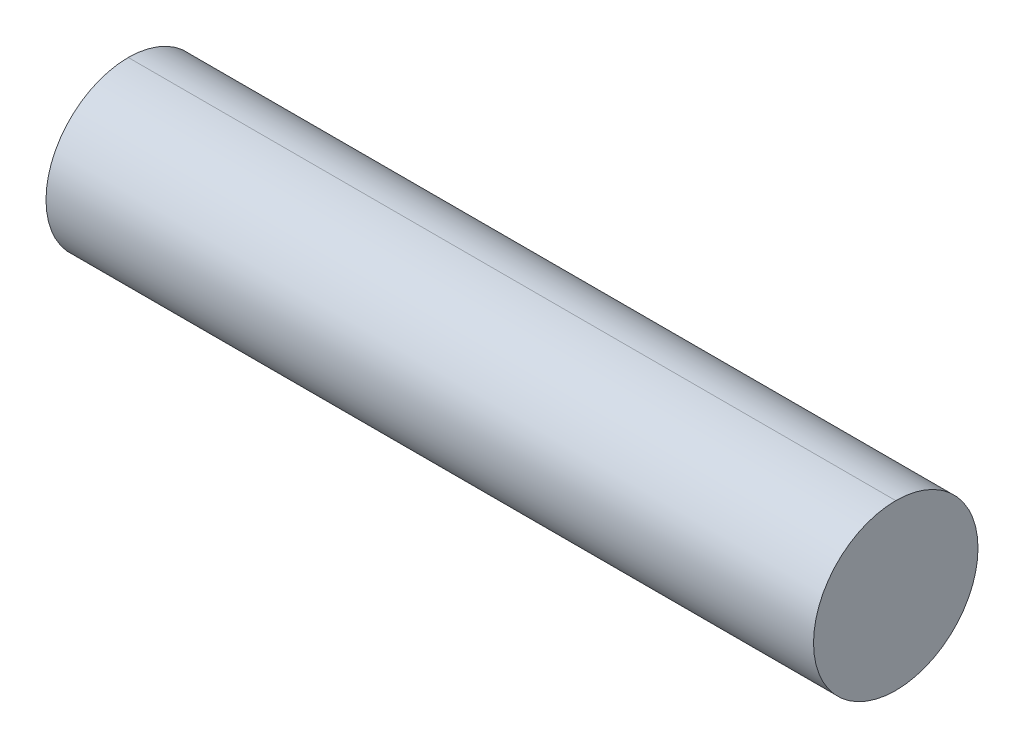
from build123d import *

# Parameters (mm, degrees)
SKETCH1_R           = 19.05
BOSS_EXTRUDE1_DEPTH = 177.8


with BuildPart() as part:
    # Sketch1 → Boss-Extrude1 (new body)
    with BuildSketch(Plane(origin=(0, 0, 0), x_dir=(0, 0, -1), z_dir=(1, 0, 0))):
        Circle(SKETCH1_R)
    extrude(amount=BOSS_EXTRUDE1_DEPTH)


solid = part.part
